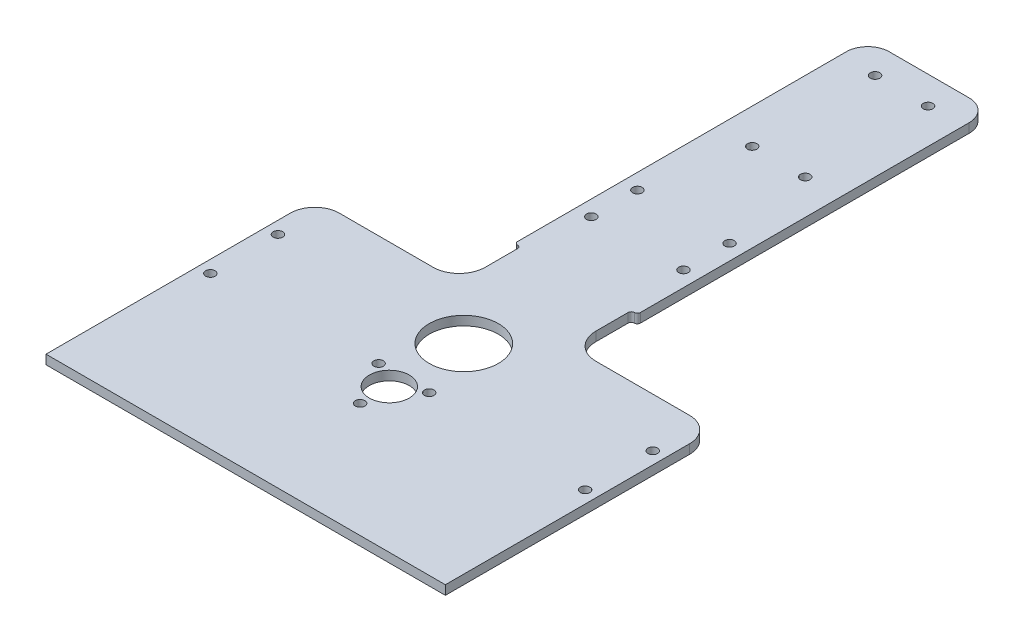
from build123d import *

# Parameters (mm, degrees)
SKETCH_1_W              = 200
SKETCH_1_H              = 200
EXTRUDE_1_DEPTH         = 3
SKETCH_2_R              = 1.5
CUT_EXTRUDE_2_DEPTH     = 10
CUT_EXTRUDE_3_DEPTH     = 10
SKETCH_6_R              = 1.55
CUT_EXTRUDE_3_1_1_DEPTH = 10
CUT_EXTRUDE_6_REACH     = 111.495
SKETCH_11_R             = 1.5
CUT_EXTRUDE_22_5_REACH  = 111.495
SKETCH_4_R              = 11.25
FILLET_1_R              = 1
SKETCH_12_W             = 40
SKETCH_12_H             = 3
EXTRUDE_2_DEPTH         = 75
FILLET_2_R              = 7
SKETCH_13_R             = 1.55
CUT_EXTRUDE_3_1_DEPTH   = 10
SKETCH_16_R             = 1.55
SKETCH_16_R_2           = 6.5
CUT_EXTRUDE_6242_DEPTH  = 10
SKETCH_18_W             = 87.5
SKETCH_18_H             = 3
EXTRUDE_3_DEPTH         = 20.5
SKETCH_19_W             = 87.5
SKETCH_19_H             = 3
EXTRUDE_4_DEPTH         = 20.5
SKETCH_7_R              = 1.55
CUT_EXTRUDE_7_DEPTH     = 20.5
FILLET_3_R              = 8


with BuildPart() as part:
    # 草图1 → 凸台-拉伸1 (new body)
    with BuildSketch(Plane(origin=(0, 0, 0), x_dir=(1, 0, 0), z_dir=(0, 1, 0))):
        Rectangle(SKETCH_1_W, SKETCH_1_H)
    extrude(amount=EXTRUDE_1_DEPTH)

    # 草图2 → 切除-拉伸2 (cut)
    with BuildSketch(Plane(origin=(0, 3, 0), x_dir=(1, 0, 0), z_dir=(0, 1, 0))):
        with Locations(Location((29.5, 9.5, 0), (0, 0, 270))):
            Circle(SKETCH_2_R)
        with Locations(Location((21.5, 0, 0), (0, 0, 270))):
            Circle(SKETCH_2_R)
        with Locations(Location((29.5, -9.5, 0), (0, 0, 270))):
            Circle(SKETCH_2_R)
        with Locations(Location((37.5, 0, 0), (0, 0, 270))):
            Circle(SKETCH_2_R)
        with Locations(Location((-29.5, -9.5, 0), (0, 0, 270))):
            Circle(SKETCH_2_R)
        with Locations(Location((-37.5, 0, 0), (0, 0, 270))):
            Circle(SKETCH_2_R)
        with Locations(Location((-21.5, 0, 0), (0, 0, 270))):
            Circle(SKETCH_2_R)
        with Locations(Location((-29.5, 9.5, 0), (0, 0, 270))):
            Circle(SKETCH_2_R)
    extrude(amount=-CUT_EXTRUDE_2_DEPTH, mode=Mode.SUBTRACT)

    # 草图5 → 切除-拉伸3 (cut)
    with BuildSketch(Plane(origin=(0, 3, 0), x_dir=(1, 0, 0), z_dir=(0, 1, 0))):
        with BuildLine():
            Line((-100, -100), (-44.5, -100))
            Line((-44.5, -100), (-44.5, 0))
            ThreePointArc((-44.5, 0), (-40.212142643, 10.5), (-29.8, 14.9969997))
            ThreePointArc((-29.8, 14.9969997), (-22.858571571, 17.9949995), (-20, 24.9949995))
            Line((-20, 24.9949995), (-20, 47.5))
            Line((-20, 47.5), (0, 47.5))
            Line((0, 47.5), (20, 47.5))
            Line((20, 47.5), (20, 24.9949995))
            ThreePointArc((20, 24.9949995), (22.858571571, 17.9949995), (29.8, 14.9969997))
            ThreePointArc((29.8, 14.9969997), (40.212142643, 10.5), (44.5, 0))
            Line((44.5, 0), (44.5, -100))
            Line((44.5, -100), (100, -100))
            Line((100, -100), (100, 100))
            Line((100, 100), (-100, 100))
            Line((-100, 100), (-100, -100))
        make_face()
    extrude(amount=-CUT_EXTRUDE_3_DEPTH, mode=Mode.SUBTRACT)

    # 草图6 → φ3.1通孔1 (cut)
    with BuildSketch(Plane.XZ):
        with Locations(Location((-15, -42.5, 0), (0, 0, 270))):
            Circle(SKETCH_6_R)
        with Locations(Location((-15, -27.5, 0), (0, 0, 270))):
            Circle(SKETCH_6_R)
        with Locations(Location((15, -27.5, 0), (0, 0, 90))):
            Circle(SKETCH_6_R)
        with Locations(Location((15, -42.5, 0), (0, 0, 90))):
            Circle(SKETCH_6_R)
    extrude(amount=-CUT_EXTRUDE_3_1_1_DEPTH, mode=Mode.SUBTRACT)

    # 草图11 → 切除-拉伸6 (cut, up to next)
    with BuildSketch(Plane(origin=(0, 3, 0), x_dir=(1, 0, 0), z_dir=(0, 1, 0)), mode=Mode.PRIVATE) as cut_extrude_6_sk1:
        with BuildLine():
            Line((44.5, -17.5), (44.5, -100))
            Line((44.5, -100), (101.133062566, -100))
            Line((101.133062566, -100), (101.133062566, 47.5))
            Line((101.133062566, 47.5), (20, 47.5))
            Line((20, 47.5), (20, 7.5))
            Line((20, 7.5), (19, 7.5))
            ThreePointArc((19, 7.5), (18.292893219, 7.207106781), (18, 6.5))
            Line((18, 6.5), (18, -4))
            ThreePointArc((18, -4), (20.48959236, -10.01040764), (26.5, -12.5))
            Line((26.5, -12.5), (39.5, -12.5))
            Line((39.5, -12.5), (44.5, -12.5))
            Line((44.5, -12.5), (44.5, -17.5))
        make_face()
        with Locations((29.5, -9.5)):
            Circle(SKETCH_11_R, mode=Mode.SUBTRACT)
        with Locations((21.5, 0)):
            Circle(SKETCH_11_R, mode=Mode.SUBTRACT)
    cut_extrude_6_tool1 = extrude(cut_extrude_6_sk1.sketch, amount=-CUT_EXTRUDE_6_REACH, mode=Mode.PRIVATE) & part.part
    # 草图11 → 切除-拉伸6 (cut, up to next)
    with BuildSketch(Plane(origin=(0, 3, 0), x_dir=(1, 0, 0), z_dir=(0, 1, 0)), mode=Mode.PRIVATE) as cut_extrude_6_sk2:
        with BuildLine():
            Line((-44.5, -17.5), (-44.5, -100))
            Line((-44.5, -100), (-101.133062566, -100))
            Line((-101.133062566, -100), (-101.133062566, 47.5))
            Line((-101.133062566, 47.5), (-20, 47.5))
            Line((-20, 47.5), (-20, 7.5))
            Line((-20, 7.5), (-19, 7.5))
            ThreePointArc((-19, 7.5), (-18.292893219, 7.207106781), (-18, 6.5))
            Line((-18, 6.5), (-18, -4))
            ThreePointArc((-18, -4), (-20.48959236, -10.01040764), (-26.5, -12.5))
            Line((-26.5, -12.5), (-39.5, -12.5))
            Line((-39.5, -12.5), (-44.5, -12.5))
            Line((-44.5, -12.5), (-44.5, -17.5))
        make_face()
    cut_extrude_6_tool2 = extrude(cut_extrude_6_sk2.sketch, amount=-CUT_EXTRUDE_6_REACH, mode=Mode.PRIVATE) & part.part
    add(cut_extrude_6_tool1.solids().sort_by_distance((66.686037, 3, 19.669577))[0], mode=Mode.SUBTRACT)
    add(cut_extrude_6_tool2.solids().sort_by_distance((-66.626911, 3, 19.648158))[0], mode=Mode.SUBTRACT)

    # 草图4 → φ22.5落弹孔 (cut, up to next)
    with BuildSketch(Plane(origin=(0, 3, 0), x_dir=(1, 0, 0), z_dir=(0, 1, 0)), mode=Mode.PRIVATE) as cut_extrude_22_5_sk1:
        with Locations(Location((0, -29, 0), (0, 0, 270))):
            Circle(SKETCH_4_R)
    cut_extrude_22_5_tool1 = extrude(cut_extrude_22_5_sk1.sketch, amount=-CUT_EXTRUDE_22_5_REACH, mode=Mode.PRIVATE) & part.part
    add(cut_extrude_22_5_tool1.solids().sort_by_distance((0, 3, 29))[0], mode=Mode.SUBTRACT)

    # 圆角1
    fillet_1_edges = [part.edges().sort_by_distance(p)[0] for p in [
        (-20, 1.5, -7.5),
        (20, 1.5, -7.5),
    ]]
    fillet(fillet_1_edges, radius=FILLET_1_R - 0.0001)  # a hair under: the kernel refuses the full size

    # 草图12 → 凸台-拉伸2 (add)
    with BuildSketch(Plane(origin=(0, 0, -47.5), x_dir=(-1, 0, 0), z_dir=(0, 0, -1))):
        with Locations((0, 1.5)):
            Rectangle(SKETCH_12_W, SKETCH_12_H)
    extrude(amount=EXTRUDE_2_DEPTH)

    # 圆角2
    fillet_2_edges = [part.edges().sort_by_distance(p)[0] for p in [
        (20, 1.5, -122.5),
        (-20, 1.5, -122.5),
    ]]
    fillet(fillet_2_edges, radius=FILLET_2_R)

    # 草图13 → φ3.1通孔 (cut)
    with BuildSketch(Plane(origin=(0, 3, 0), x_dir=(1, 0, 0), z_dir=(0, 1, 0))):
        with Locations(Location((-8.625, 113.5, 0), (0, 0, 270))):
            Circle(SKETCH_13_R)
        with Locations(Location((8.625, 113.5, 0), (0, 0, 270))):
            Circle(SKETCH_13_R)
        with Locations(Location((8.625, 73.5, 0), (0, 0, 270))):
            Circle(SKETCH_13_R)
        with Locations(Location((-8.625, 73.5, 0), (0, 0, 270))):
            Circle(SKETCH_13_R)
    extrude(amount=-CUT_EXTRUDE_3_1_DEPTH, mode=Mode.SUBTRACT)

    # 草图16 → Cut-Extrude 6242 (cut)
    with BuildSketch(Plane(origin=(0, 3, 0), x_dir=(1, 0, 0), z_dir=(0, 1, 0))):
        with Locations(Location((0, -62.75, 0), (0, 0, 270))):
            Circle(SKETCH_16_R)
        with Locations(Location((-8.227241336, -48.5, 0), (0, 0, 270))):
            Circle(SKETCH_16_R)
        with Locations(Location((8.227241336, -48.5, 0), (0, 0, 270))):
            Circle(SKETCH_16_R)
        with Locations(Location((0, -53.25, 0), (0, 0, 270))):
            Circle(SKETCH_16_R_2)
    extrude(amount=-CUT_EXTRUDE_6242_DEPTH, mode=Mode.SUBTRACT)

    # 草图18 → 凸台-拉伸3 (add)
    with BuildSketch(Plane.ZY.offset(44.5)):
        with Locations((56.25, 1.5)):
            Rectangle(SKETCH_18_W, SKETCH_18_H)
    extrude(amount=EXTRUDE_3_DEPTH)

    # 草图19 → 凸台-拉伸4 (add)
    with BuildSketch(Plane(origin=(44.5, 0, 0), x_dir=(0, 0, -1), z_dir=(1, 0, 0))):
        with Locations((-56.25, 1.5)):
            Rectangle(SKETCH_19_W, SKETCH_19_H)
    extrude(amount=EXTRUDE_4_DEPTH)

    # 草图7 → 切除-拉伸7 (cut)
    with BuildSketch(Plane(origin=(0, 3, 0), x_dir=(1, 0, 0), z_dir=(0, 1, 0))):
        with Locations(Location((-61, -28.5, 0), (0, 0, 270))):
            Circle(SKETCH_7_R)
        with Locations(Location((-61, -50.5, 0), (0, 0, 270))):
            Circle(SKETCH_7_R)
        with Locations(Location((61, -28.5, 0), (0, 0, 270))):
            Circle(SKETCH_7_R)
        with Locations(Location((61, -50.5, 0), (0, 0, 270))):
            Circle(SKETCH_7_R)
    extrude(amount=-CUT_EXTRUDE_7_DEPTH, mode=Mode.SUBTRACT)

    # 圆角3
    fillet_3_edges = [part.edges().sort_by_distance(p)[0] for p in [
        (-65, 1.5, 12.5),
        (65, 1.5, 12.5),
    ]]
    fillet(fillet_3_edges, radius=FILLET_3_R)


solid = part.part
